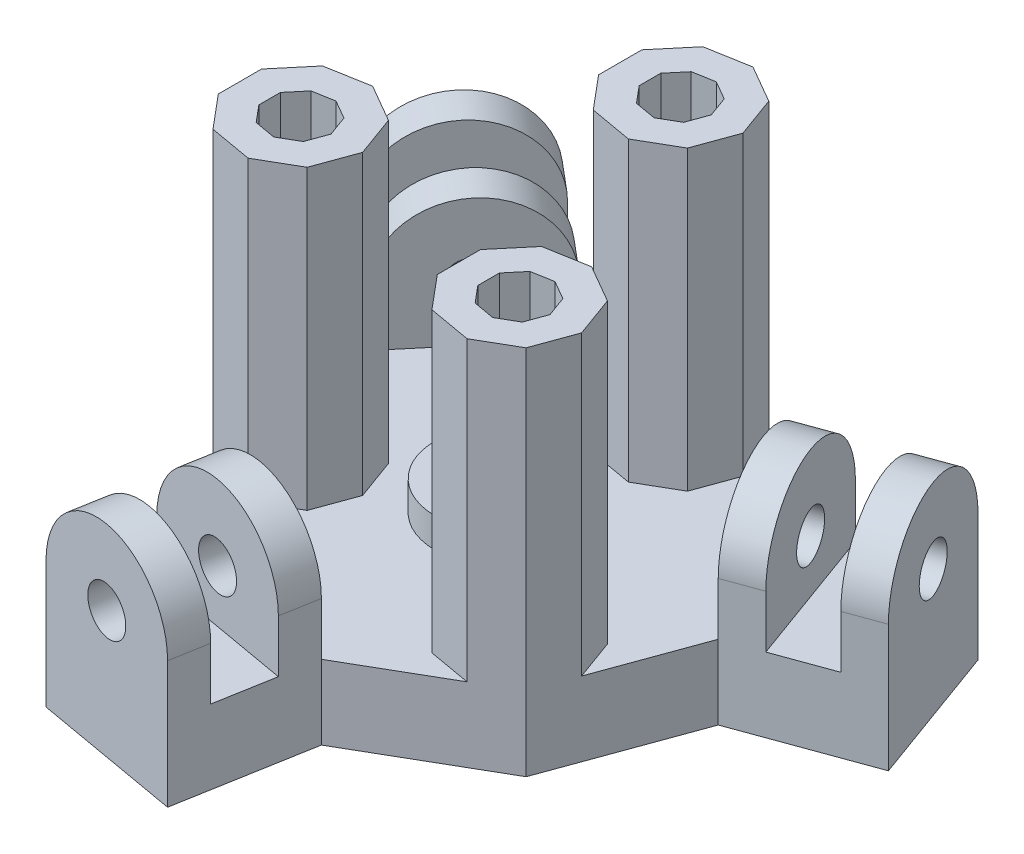
from build123d import *

# Parameters (mm, degrees)
SKETCH1_R            = 4.1
BOSS_EXTRUDE1_DEPTH  = 6.35
SKETCH4_R            = 1.999996
BOSS_EXTRUDE2_DEPTH  = 3.18
BOSS_EXTRUDE4_START  = -3.175
SKETCH6_R            = 1.999996081
BOSS_EXTRUDE4_DEPTH  = 3.175
SKETCH8_R            = 1.999996
BOSS_EXTRUDE5_DEPTH  = 3.175
BOSS_EXTRUDE6_START  = -3.175
SKETCH9_R            = 1.999996
BOSS_EXTRUDE6_DEPTH  = 3.175
SKETCH10_R           = 1.999996
BOSS_EXTRUDE7_DEPTH  = 3.175
BOSS_EXTRUDE8_START  = -3.175
SKETCH11_R           = 1.999996
BOSS_EXTRUDE8_DEPTH  = 3.175
BOSS_EXTRUDE9_DEPTH  = 25.4
SKETCH15_R           = 5.5
SKETCH15_R_2         = 4
BOSS_EXTRUDE10_DEPTH = 2.54


with BuildPart() as part:
    # Sketch1 → Boss-Extrude1 (new body)
    with BuildSketch(Plane(origin=(0, 0, 0), x_dir=(1, 0, 0), z_dir=(0, 1, 0))):
        Polygon((-17.597636128, 6.405015744), (-17.597636128, -6.405015744), (-9.363506608, -16.218069182), (-11.334413409, -27.39563709), (1.281004917, -29.620075713), (3.251911718, -18.442507805), (14.34572441, -12.037492061), (18.727013216, 0), (29.392524377, 3.881928596), (25.011235571, 15.919420657), (14.34572441, 12.037492061), (3.251911718, 18.442507805), (-9.363506608, 16.218069182), (-18.058110968, 23.513708494), (-26.292240488, 13.700655056), align=None)
        Circle(SKETCH1_R, mode=Mode.SUBTRACT)
    extrude(amount=BOSS_EXTRUDE1_DEPTH)

    # Sketch4 → Boss-Extrude2 (add)
    with BuildSketch(Plane(origin=(-5.026704246, 0, 28.507856402), x_dir=(-0.984807753012208, 0, -0.1736481776669305), z_dir=(0.1736481776669305, 0, -0.9848077530122081))):
        with BuildLine():
            Line((-6.405015744, 6.35), (-6.405015744, 10.84999989))
            ThreePointArc((-6.405015744, 10.84999989), (0, 17.255015634), (6.405015744, 10.84999989))
            Line((6.405015744, 10.84999989), (6.405015744, 6.35))
            Line((6.405015744, 6.35), (-6.405015744, 6.35))
        make_face()
        with Locations((0, 10.84999989)):
            Circle(SKETCH4_R, mode=Mode.SUBTRACT)
    extrude(amount=BOSS_EXTRUDE2_DEPTH)

    # Sketch6 → Boss-Extrude4 (add)
    with BuildSketch(Plane(origin=(-3.055797445, 0, 17.330288494), x_dir=(-0.9848077530122081, 0, -0.17364817766693072), z_dir=(0.17364817766693072, 0, -0.9848077530122081)).offset(BOSS_EXTRUDE4_START)):
        with BuildLine():
            Line((-6.405015744, 6.35), (-6.405015744, 10.85))
            ThreePointArc((-6.405015744, 10.85), (0, 17.255015744), (6.405015744, 10.85))
            Line((6.405015744, 10.85), (6.405015744, 6.35))
            Line((6.405015744, 6.35), (-6.405015744, 6.35))
        make_face()
        with Locations((0, 10.85)):
            Circle(SKETCH6_R, mode=Mode.SUBTRACT)
    extrude(amount=BOSS_EXTRUDE4_DEPTH)

    # Sketch8 → Boss-Extrude5 (add)
    with BuildSketch(Plane(origin=(27.201879974, 0, -9.900674627), x_dir=(0.3420201433256691, 0, 0.9396926207859083), z_dir=(-0.9396926207859084, 0, 0.3420201433256691))):
        with BuildLine():
            Line((-6.405015744, 10.85), (-6.405015744, 6.35))
            Line((-6.405015744, 6.35), (6.405015744, 6.35))
            Line((6.405015744, 6.35), (6.405015744, 10.85))
            ThreePointArc((6.405015744, 10.85), (0, 17.255015744), (-6.405015744, 10.85))
        make_face()
        with Locations((0, 10.85)):
            Circle(SKETCH8_R, mode=Mode.SUBTRACT)
    extrude(amount=BOSS_EXTRUDE5_DEPTH)

    # Sketch9 → Boss-Extrude6 (add)
    with BuildSketch(Plane(origin=(16.536368813, 0, -6.018746031), x_dir=(0.34202014332566877, 0, 0.9396926207859084), z_dir=(-0.9396926207859085, 0, 0.34202014332566877)).offset(BOSS_EXTRUDE6_START)):
        with BuildLine():
            Line((-6.405015744, 6.35), (-6.405015744, 10.85))
            ThreePointArc((-6.405015744, 10.85), (0, 17.255015744), (6.405015744, 10.85))
            Line((6.405015744, 10.85), (6.405015744, 6.35))
            Line((6.405015744, 6.35), (-6.405015744, 6.35))
        make_face()
        with Locations((0, 10.85)):
            Circle(SKETCH9_R, mode=Mode.SUBTRACT)
    extrude(amount=BOSS_EXTRUDE6_DEPTH)

    # Sketch10 → Boss-Extrude7 (add)
    with BuildSketch(Plane(origin=(-22.175175728, 0, -18.607181775), x_dir=(0.6427876096865388, 0, -0.7660444431189786), z_dir=(0.7660444431189786, 0, 0.6427876096865388))):
        with BuildLine():
            Line((-6.405015744, 10.85), (-6.405015744, 6.35))
            Line((-6.405015744, 6.35), (6.405015744, 6.35))
            Line((6.405015744, 6.35), (6.405015744, 10.85))
            ThreePointArc((6.405015744, 10.85), (0, 17.255015744), (-6.405015744, 10.85))
        make_face()
        with Locations((0, 10.85)):
            Circle(SKETCH10_R, mode=Mode.SUBTRACT)
    extrude(amount=BOSS_EXTRUDE7_DEPTH)

    # Sketch11 → Boss-Extrude8 (add)
    with BuildSketch(Plane(origin=(-13.480571368, 0, -11.311542463), x_dir=(0.6427876096865398, 0, -0.7660444431189777), z_dir=(0.7660444431189777, 0, 0.6427876096865398)).offset(BOSS_EXTRUDE8_START)):
        with BuildLine():
            Line((-6.405015744, 10.85), (-6.405015744, 6.35))
            Line((-6.405015744, 6.35), (6.405015744, 6.35))
            Line((6.405015744, 6.35), (6.405015744, 10.85))
            ThreePointArc((6.405015744, 10.85), (0, 17.255015744), (-6.405015744, 10.85))
        make_face()
        with Locations((0, 10.85)):
            Circle(SKETCH11_R, mode=Mode.SUBTRACT)
    extrude(amount=BOSS_EXTRUDE8_DEPTH)

    # Sketch12 → Boss-Extrude9 (add)
    # profile 1 of 3: a face of its own
    with BuildSketch(Plane(origin=(0, 6.35, 0), x_dir=(1, 0, 0), z_dir=(0, 1, 0))):
        Polygon((14.34572441, -12.037492061), (15.610493551, -8.562567405), (14.34572441, -5.087642749), (11.143216524, -3.238673959), (7.501458925, -3.880814081), (5.124470467, -6.713598615), (5.124470467, -10.411536195), (7.501458925, -13.24432073), (11.143216524, -13.886460851), align=None)
        Polygon((12.275097438, -10.300029733), (12.907482009, -8.562567405), (12.275097438, -6.825105077), (10.673843495, -5.900620682), (8.852964696, -6.221690743), (7.664470467, -7.63808301), (7.664470467, -9.4870518), (8.852964696, -10.903444067), (10.673843495, -11.224514128), align=None, mode=Mode.SUBTRACT)
    # profile 2 of 3: a face of its own
    with BuildSketch(Plane(origin=(0, 6.35, 0), x_dir=(1, 0, 0), z_dir=(0, 1, 0))):
        Polygon((6.454419604, 9.643689703), (7.719188745, 13.118614359), (6.454419604, 16.593539015), (3.251911718, 18.442507805), (-0.389845881, 17.800367684), (-2.766834339, 14.967583149), (-2.766834339, 11.269645569), (-0.389845881, 8.436861035), (3.251911718, 7.794720913), align=None)
        Polygon((-0.226834339, 12.194129964), (0.96165989, 10.777737697), (2.78253869, 10.456667636), (4.383792633, 11.381152031), (5.016177203, 13.118614359), (4.383792633, 14.856076687), (2.78253869, 15.780561082), (0.96165989, 15.459491021), (-0.226834339, 14.043098754), align=None, mode=Mode.SUBTRACT)
    # profile 3 of 3: a face of its own
    with BuildSketch(Plane(origin=(0, 6.35, 0), x_dir=(1, 0, 0), z_dir=(0, 1, 0))):
        Polygon((-17.597636128, -6.405015744), (-15.22064767, -9.237800278), (-11.578890071, -9.8799404), (-8.376382185, -8.03097161), (-7.111613044, -4.556046954), (-8.376382185, -1.081122298), (-11.578890071, 0.767846492), (-15.22064767, 0.12570637), (-17.597636128, -2.707078164), align=None)
        Polygon((-10.447009156, -6.293509282), (-9.814624586, -4.556046954), (-10.447009156, -2.818584626), (-12.0482631, -1.894100231), (-13.869141899, -2.215170292), (-15.057636128, -3.631562559), (-15.057636128, -5.480531349), (-13.869141899, -6.896923616), (-12.0482631, -7.217993677), align=None, mode=Mode.SUBTRACT)
    extrude(amount=BOSS_EXTRUDE9_DEPTH)

    # Sketch15 → Boss-Extrude10 (add)
    with BuildSketch(Plane(origin=(0, 6.35, 0), x_dir=(1, 0, 0), z_dir=(0, 1, 0))):
        Circle(SKETCH15_R)
        Circle(SKETCH15_R_2, mode=Mode.SUBTRACT)
    extrude(amount=BOSS_EXTRUDE10_DEPTH)


solid = part.part
